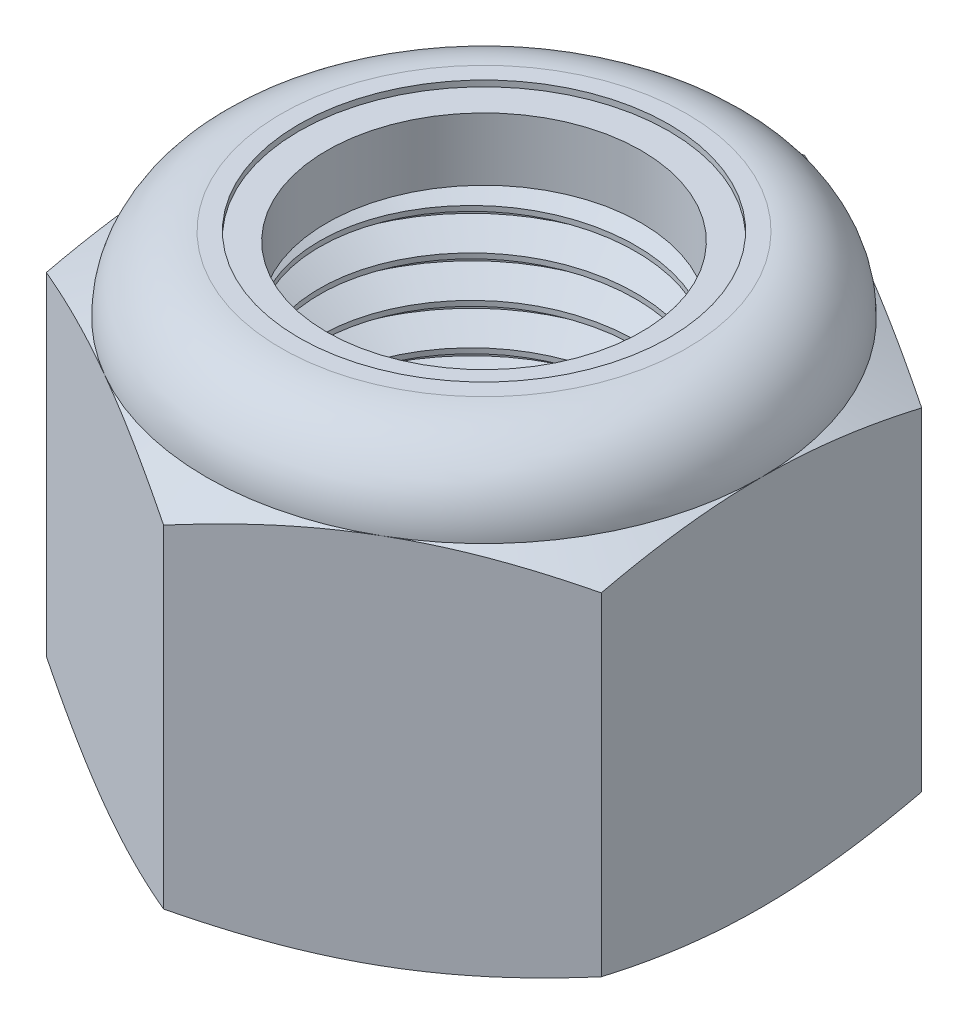
from build123d import *

# Parameters (mm, degrees)
SKETCH1_R        = 4.7625
EXTRUDE1_DEPTH   = 11.509375
SKETCH2_W        = 4.7625
SKETCH2_H        = 9.591145833
CUT_SWEEP1_PITCH = 1.058333333
SKETCH12_W       = 5.23875
SKETCH12_H       = 9.591145833


with BuildPart() as part:
    # Sketch1 → Extrude1 (new body)
    with BuildSketch(Plane(origin=(0, 0, 0), x_dir=(1, 0, 0), z_dir=(0, 1, 0))):
        Polygon((0, 8.248891971), (-7.14375, 4.124445986), (-7.14375, -4.124445986), (0, -8.248891971), (7.14375, -4.124445986), (7.14375, 4.124445986), align=None)
        with Locations(Location((0, 0, 0), (0, 0, 270))):
            Circle(SKETCH1_R, mode=Mode.SUBTRACT)
    extrude(amount=EXTRUDE1_DEPTH)

    # Sketch5 → Cut-Revolve3 (revolve, cut)
    with BuildSketch(Plane(origin=(0, 0, 0), x_dir=(0, 0, -1), z_dir=(1, 0, 0))):
        with BuildLine():
            Line((0, 0), (7.14375, 0))
            Line((7.14375, 0), (8.248891971, 0.515336164))
            Line((8.248891971, 0.515336164), (8.248891971, 9.075809669))
            Line((8.248891971, 9.075809669), (7.14375, 9.591145833))
            ThreePointArc((7.14375, 9.591145833), (6.581913685, 10.947538685), (5.225520833, 11.509375))
            Line((5.225520833, 11.509375), (5.225520833, 12.779375))
            Line((5.225520833, 12.779375), (9.518891971, 12.779375))
            Line((9.518891971, 12.779375), (9.518891971, -1.27))
            Line((9.518891971, -1.27), (0, -1.27))
            Line((0, -1.27), (0, 0))
        make_face()
    revolve(axis=Axis((0, 0, 0), (0, 1, 0)), mode=Mode.SUBTRACT)

    # Sketch6 → Cut-Revolve4 (revolve, cut)
    with BuildSketch(Plane(origin=(0, 0, 0), x_dir=(0, 0, -1), z_dir=(1, 0, 0)), mode=Mode.PRIVATE) as cut_revolve4_sk:
        with BuildLine():
            Line((0, 9.591145833), (6.99135, 9.591145833))
            ThreePointArc((6.99135, 9.591145833), (6.474150612, 10.839775612), (5.225520833, 11.356975))
            Line((5.225520833, 11.356975), (2.612760417, 11.356975))
            Line((2.612760417, 11.356975), (2.612760417, 12.779375))
            Line((2.612760417, 12.779375), (0, 12.779375))
            Line((0, 12.779375), (0, 9.591145833))
        make_face()
    revolve(cut_revolve4_sk.sketch.rotate(Axis((0, 12.779375, 0), (0, -1, 0)), 180), axis=Axis((0, 12.779375, 0), (0, -1, 0)), mode=Mode.SUBTRACT)

    # Sketch4 → Cut-Revolve2 (revolve, cut)
    with BuildSketch(Plane(origin=(0, 0, 0), x_dir=(0, 0, -1), z_dir=(1, 0, 0))):
        Polygon((0, 9.591145833), (5.23875, 9.591145833), (0, 7.148276589), align=None)
        Polygon((0, 2.442869244), (5.23875, 0), (0, 0), align=None)
    revolve(axis=Axis((0, 0, 0), (0, 1, 0)), mode=Mode.SUBTRACT)

    # Sketch12 → Revolve4 (revolve)
    with BuildSketch(Plane(origin=(0, 0, 0), x_dir=(0, 0, -1), z_dir=(1, 0, 0)), mode=Mode.PRIVATE) as revolve4_sk:
        with Locations((2.619375, 4.795572917)):
            Rectangle(SKETCH12_W, SKETCH12_H)
    revolve(revolve4_sk.sketch.rotate(Axis((0, 0, 0), (0, 1, 0)), 341.964875998), axis=Axis((0, 0, 0), (0, 1, 0)))


with BuildPart() as body_2:
    # Sketch7 → Revolve2 (revolve)
    with BuildSketch(Plane(origin=(0, 0, 0), x_dir=(0, 0, -1), z_dir=(1, 0, 0))):
        with BuildLine():
            Line((4.048125, 9.667345833), (6.913430867, 9.667345833))
            ThreePointArc((6.913430867, 9.667345833), (6.39301751, 10.812537757), (5.225520833, 11.280775))
            Line((5.225520833, 11.280775), (4.048125, 11.280775))
            Line((4.048125, 11.280775), (4.048125, 9.667345833))
        make_face()
    revolve(axis=Axis((0, 9.667345833, 0), (0, 1, 0)))


with BuildPart() as body_3:
    # Sketch2 → Revolve1 (revolve)
    with BuildSketch(Plane(origin=(0, 0, 0), x_dir=(0, 0, -1), z_dir=(1, 0, 0))):
        with Locations((2.38125, 4.795572917)):
            Rectangle(SKETCH2_W, SKETCH2_H)
    revolve(axis=Axis((0, -4.7625, 0), (0, 1, 0)))

    # Cut-Sweep1: the profile of Sketch9 screwed along a right-hand helix of 11.875 turns, 8 arcs to a turn; built about Z, then put on its axis
    cut_sweep1_z = Axis((0, 0, 0), (0, 0, 1))
    cut_sweep1_corners = [(4.877067944, 0, 0.066145833), (4.819783972, 0, -0.959114583), (4.075092336, 0, -0.529166667), (4.075092336, 0, -0.396875)]
    with BuildLine(mode=Mode.PRIVATE) as cut_sweep1_profile:
        Line(cut_sweep1_corners[0], cut_sweep1_corners[1])
        Line(cut_sweep1_corners[1], cut_sweep1_corners[2])
        Line(cut_sweep1_corners[2], cut_sweep1_corners[3])
        Line(cut_sweep1_corners[3], cut_sweep1_corners[0])
    cut_sweep1_cap = Face(cut_sweep1_profile.wire())
    cut_sweep1_turn_angles = [0, 22.5, 45, 67.5, 90, 112.5, 135, 157.5, 180, 202.5, 225, 247.5, 270, 292.5, 315, 337.5, 360]
    cut_sweep1_turn_weights = [1, 0.9238795325112867, 1, 0.9238795325112867, 1, 0.9238795325112867, 1, 0.9238795325112867, 1, 0.9238795325112867, 1, 0.9238795325112867, 1, 0.9238795325112867, 1, 0.9238795325112867, 1]
    cut_sweep1_turn_rails = [Edge.make_bspline([Vector(p[0], p[1], 0).rotate(cut_sweep1_z, cut_sweep1_turn_angles[k]) / cut_sweep1_turn_weights[k] + Vector(0, 0, p[2] + CUT_SWEEP1_PITCH * cut_sweep1_turn_angles[k] / 360) for k in range(17)], [0, 0, 0, 1, 1, 2, 2, 3, 3, 4, 4, 5, 5, 6, 6, 7, 7, 8, 8, 8], 2, cut_sweep1_turn_weights) for p in cut_sweep1_corners]
    cut_sweep1_turn_sides = [Face.make_surface_from_curves(cut_sweep1_turn_rails[p[0]], cut_sweep1_turn_rails[p[1]]) for p in [(0, 1), (1, 2), (2, 3), (3, 0)]]
    cut_sweep1_last_angles = [3960, 3982.5, 4005, 4027.5, 4050, 4072.5, 4095, 4117.5, 4140, 4162.5, 4185, 4207.5, 4230, 4252.5, 4275]
    cut_sweep1_last_weights = [1, 0.9238795325112867, 1, 0.9238795325112867, 1, 0.9238795325112867, 1, 0.9238795325112867, 1, 0.9238795325112867, 1, 0.9238795325112867, 1, 0.9238795325112412, 1]
    cut_sweep1_last_rails = [Edge.make_bspline([Vector(p[0], p[1], 0).rotate(cut_sweep1_z, cut_sweep1_last_angles[k]) / cut_sweep1_last_weights[k] + Vector(0, 0, p[2] + CUT_SWEEP1_PITCH * cut_sweep1_last_angles[k] / 360) for k in range(15)], [0, 0, 0, 1, 1, 2, 2, 3, 3, 4, 4, 5, 5, 6, 6, 7, 7, 7], 2, cut_sweep1_last_weights) for p in cut_sweep1_corners]
    cut_sweep1_last_sides = [Face.make_surface_from_curves(cut_sweep1_last_rails[p[0]], cut_sweep1_last_rails[p[1]]) for p in [(0, 1), (1, 2), (2, 3), (3, 0)]]
    cut_sweep1 = Plane(origin=(0, 9.591145833, 0), x_dir=(0, 0, -1), z_dir=(0, -1, 0)) * Solid(Shell([*[p.moved(Location((0, 0, CUT_SWEEP1_PITCH * i))) for i in range(11) for p in cut_sweep1_turn_sides], *cut_sweep1_last_sides, cut_sweep1_cap, cut_sweep1_cap.rotate(cut_sweep1_z, 4275).moved(Location((0, 0, CUT_SWEEP1_PITCH * 4275 / 360)))]))
    add(cut_sweep1, mode=Mode.SUBTRACT)

    # Sketch11 → Revolve3 (revolve)
    with BuildSketch(Plane(origin=(0, 0, 0), x_dir=(0, 0, -1), z_dir=(1, 0, 0))):
        Polygon((0, 0), (5.23875, 0), (0, 2.442869244), align=None)
    revolve(axis=Axis((0, 11.509375, 0), (0, -1, 0)))


with BuildPart() as part_1:
    add(part.part)

    # Combine1: cut body 3
    add(body_3.part, mode=Mode.SUBTRACT)


solid = Compound([body_2.part, part_1.part])
